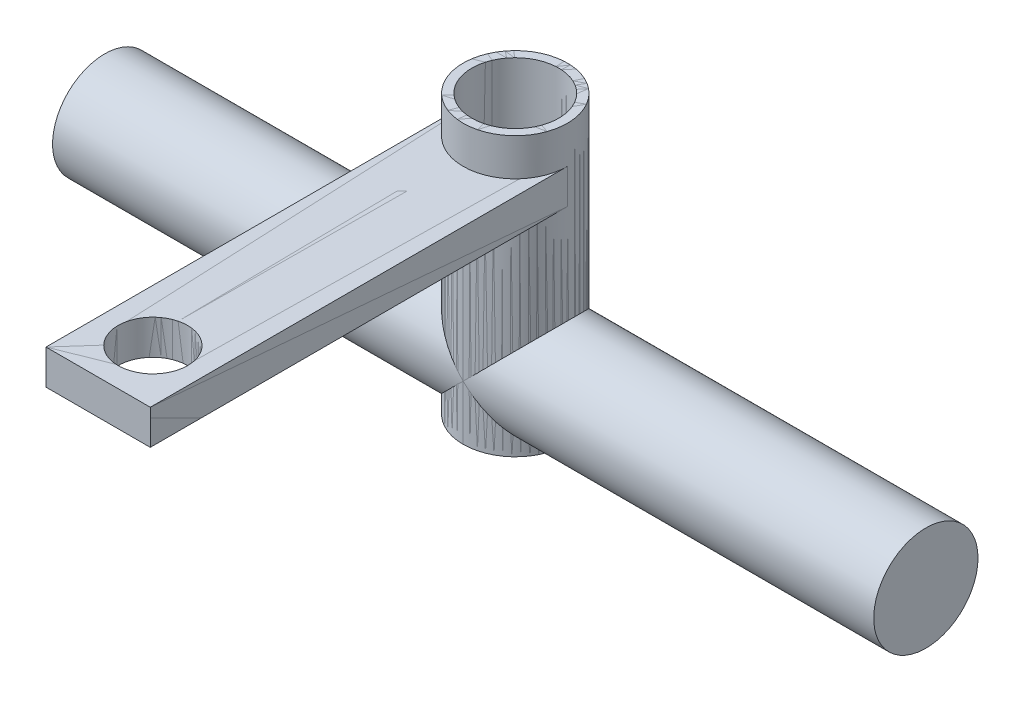
from build123d import *

# Parameters (mm, degrees)
SKETCH1_R          = 9.525
SLEEVE_DEPTH       = 50.8
SKETCH2_W          = 19.05
SKETCH2_H          = 6.35
BRACKET_DEPTH      = 76.2
SKETCH4_R          = 6.35
BRACKET_HOLE_DEPTH = 93.075
SKETCH5_R          = 9.525
SHAFT_DEPTH        = 75
SKETCH6_R          = 7.9375
SLEEVE_HOLE_DEPTH  = 119.372631972


with BuildPart() as part:
    # Sketch1 → Sleeve (new body)
    with BuildSketch(Plane(origin=(0, 0, 0), x_dir=(1, 0, 0), z_dir=(0, 1, 0))):
        Circle(SKETCH1_R)
    extrude(amount=SLEEVE_DEPTH)

    # Sketch2 → Bracket (add)
    with BuildSketch(Plane.XY):
        with Locations((0, 40.8)):
            Rectangle(SKETCH2_W, SKETCH2_H)
    extrude(amount=BRACKET_DEPTH)

    # Sketch4 → Bracket Hole (cut, through all)
    with BuildSketch(Plane(origin=(0, 0, 0), x_dir=(1, 0, 0), z_dir=(0, 1, 0))):
        with Locations((0, -66.2)):
            Circle(SKETCH4_R)
    extrude(amount=BRACKET_HOLE_DEPTH, mode=Mode.SUBTRACT)

    # Sketch5 → Shaft (add)
    with BuildSketch(Plane(origin=(0, 0, 0), x_dir=(0, 0, -1), z_dir=(1, 0, 0))):
        with Locations((0, 10)):
            Circle(SKETCH5_R)
    extrude(amount=SHAFT_DEPTH)

    # Sketch6 → Sleeve Hole (cut, through all)
    with BuildSketch(Plane(origin=(0, 0, 0), x_dir=(1, 0, 0), z_dir=(0, 1, 0))):
        Circle(SKETCH6_R)
    extrude(amount=SLEEVE_HOLE_DEPTH, mode=Mode.SUBTRACT)


with BuildPart() as body_2:
    # Mirror1: mirrored copy
    add(part.part.mirror(Plane(origin=(0, 0, 0), x_dir=(0, 0, 1), z_dir=(1, 0, 0))))


solid = Compound([part.part, body_2.part])
